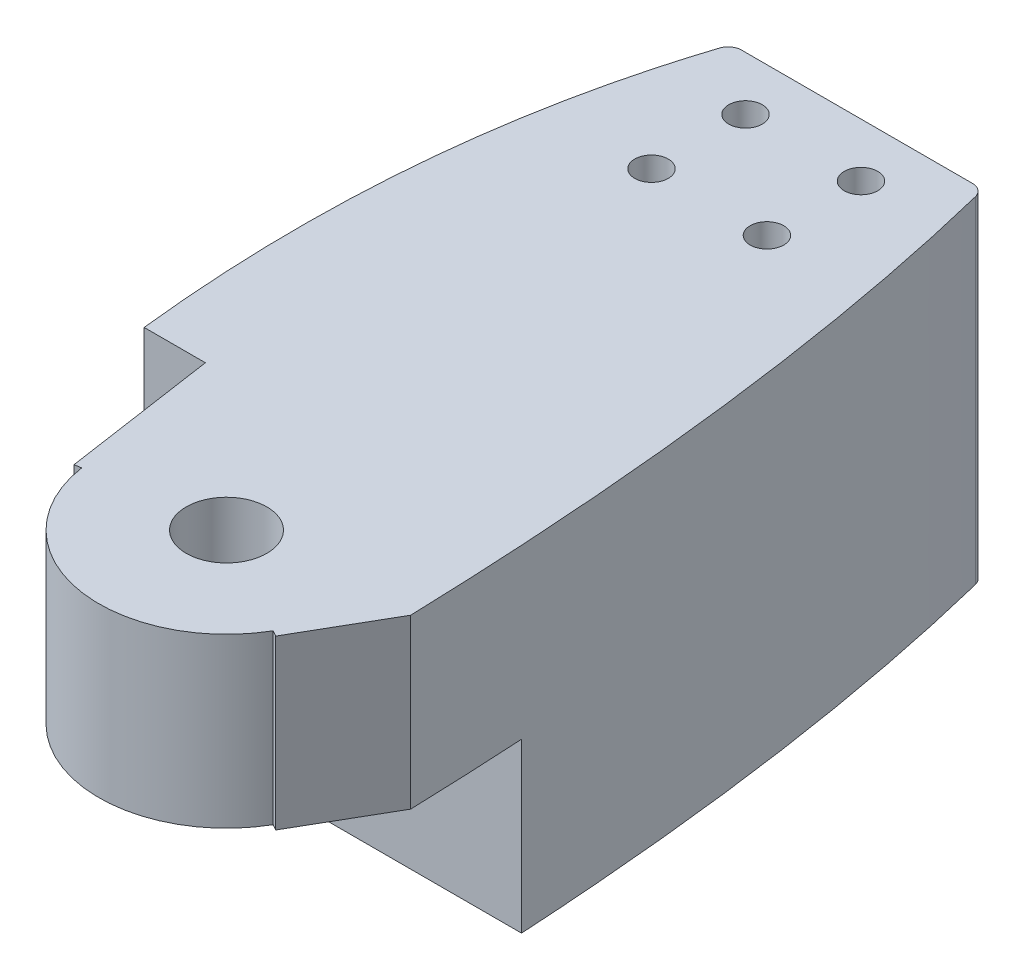
from build123d import *

# Parameters (mm, degrees)
SKETCH_1_W               = 25
SKETCH_1_H               = 25
EXTRUDE_1_DEPTH          = 59.607324229
EXTRUDE_2_DEPTH          = 25
SKETCH_6_3_OUTSIDE_W     = 45.521
SKETCH_6_3_OUTSIDE_H     = 75.803
CUT_EXTRUDE_4_DEPTH      = 25
SKETCH_2_R               = 3
CUT_EXTRUDE_1_DEPTH      = 36.344532851
SKETCH_4_W               = 45.98037926
SKETCH_4_H               = 12.5
CUT_EXTRUDE_2_DEPTH      = 19.5
CUT_EXTRUDE_5_DEPTH      = 17
FILLET_1_R               = 1
CUT_EXTRUDE_6_DEPTH      = 22
CUT_EXTRUDE_6_DEPTH_BACK = 20
SKETCH_8_R               = 1.25
CUT_EXTRUDE_7_DEPTH      = 10
CUT_EXTRUDE_7_DEPTH_BACK = 10
SKETCH_8_3_W             = 4.593346614
SKETCH_8_3_H             = 15


with BuildPart() as part:
    # 스케치1 → 보스-돌출1 (new body)
    with BuildSketch(Plane.XY):
        Rectangle(SKETCH_1_W, SKETCH_1_H)
    extrude(amount=EXTRUDE_1_DEPTH)

    # 스케치6 → 보스-돌출2 (add)
    with BuildSketch(Plane.XZ.offset(12.5)):
        with BuildLine():
            add(Edge.make_bspline(
                [(-12.5, 59.607324229), (-21.149148663, 25.914705571), (-12.5, 0)],
                knots=[0, 0, 0, 1, 1, 1], degree=2))
            Line((-12.5, 0), (-12.5, 59.607324229))
        make_face()
    extrude(amount=-EXTRUDE_2_DEPTH)

    # 스케치6<3> outside → 컷-돌출4 (cut)
    with BuildSketch(Plane.XZ.offset(12.5)):
        with Locations((-2.1625, 29.8035)):
            Rectangle(SKETCH_6_3_OUTSIDE_W, SKETCH_6_3_OUTSIDE_H)
        with BuildLine():
            Line((-12.5, 0), (6.191304912, 0))
            add(Edge.make_bspline(
                [(6.191304912, 0), (12.5, 24.95352193), (12.5, 59.607324229)],
                knots=[0, 0, 0, 1, 1, 1], degree=2))
            Line((12.5, 59.607324229), (-12.5, 59.607324229))
            add(Edge.make_bspline(
                [(-12.5, 59.607324229), (-21.149148663, 25.914705571), (-12.5, 0)],
                knots=[0, 0, 0, 1, 1, 1], degree=2))
        make_face(mode=Mode.SUBTRACT)
    extrude(amount=-CUT_EXTRUDE_4_DEPTH, mode=Mode.SUBTRACT)

    # 스케치2 → 컷-돌출1 (cut)
    with BuildSketch(Plane(origin=(0, 12.5, 0), x_dir=(1, 0, 0), z_dir=(0, 1, 0))):
        with Locations((0, -50.107324229)):
            Circle(SKETCH_2_R)
    extrude(amount=-CUT_EXTRUDE_1_DEPTH, mode=Mode.SUBTRACT)

    # 스케치4 → 컷-돌출2 (cut)
    with BuildSketch(Plane.XY.offset(59.607324229)):
        with Locations((-3.730908459, -6.25)):
            Rectangle(SKETCH_4_W, SKETCH_4_H)
    extrude(amount=-CUT_EXTRUDE_2_DEPTH, mode=Mode.SUBTRACT)

    # 스케치7 → 컷-돌출5 (cut)
    with BuildSketch(Plane.XZ):
        with BuildLine():
            ThreePointArc((0, 59.607324229), (4.75, 58.334565565), (8.227241336, 54.857324229))
            Line((8.227241336, 54.857324229), (8.660254038, 55.107324229))
            Line((8.660254038, 55.107324229), (12.337626898, 48.737927596))
            add(Edge.make_bspline(
                [(12.337626898, 48.737927596), (12.5, 54.047793075), (12.5, 59.607324229)],
                knots=[0, 0, 0, 1, 1, 1], degree=2))
            Line((12.5, 59.607324229), (0, 59.607324229))
        make_face()
        with BuildLine():
            Line((-9.8940238, 51.559320455), (-9.39932261, 51.486720644))
            ThreePointArc((-9.39932261, 51.486720644), (-6.21070584, 57.296005121), (0, 59.607324229))
            Line((0, 59.607324229), (-12.5, 59.607324229))
            add(Edge.make_bspline(
                [(-12.5, 59.607324229), (-15.09259901, 49.507896739), (-16.130924903, 40.107324229)],
                knots=[0, 0, 0, 1, 1, 1], degree=2))
            Line((-16.130924903, 40.107324229), (-11.574660076, 40.107324229))
            Line((-11.574660076, 40.107324229), (-9.8940238, 51.559320455))
        make_face()
    extrude(amount=-CUT_EXTRUDE_5_DEPTH, mode=Mode.SUBTRACT)

    # 필렛1
    fillet_1_edges = [part.edges().sort_by_distance(p)[0] for p in [
        (6.191304912, 0, 0),
        (-12.5, 0, 0),
    ]]
    fillet(fillet_1_edges, radius=FILLET_1_R)

    # 스케치8 → 컷-돌출6 (cut, two sides: drawn at the far end of the back side and taken through both)
    with BuildSketch(Plane(origin=(0, 0, 0), x_dir=(1, 0, 0), z_dir=(0, 1, 0)).offset(-CUT_EXTRUDE_6_DEPTH_BACK)):
        with Locations((1.11398045, -4)):
            Circle(SKETCH_8_R)
        with Locations((1.11398045, -11)):
            Circle(SKETCH_8_R)
        with Locations((-7.479366164, -4)):
            Circle(SKETCH_8_R)
        with Locations((-7.479366164, -11)):
            Circle(SKETCH_8_R)
    extrude(amount=CUT_EXTRUDE_6_DEPTH + CUT_EXTRUDE_6_DEPTH_BACK, mode=Mode.SUBTRACT)

    # 스케치8<3> → 컷-돌출7 (cut, two sides: drawn at the far end of the back side and taken through both)
    with BuildSketch(Plane(origin=(0, 0, 0), x_dir=(1, 0, 0), z_dir=(0, 1, 0)).offset(-CUT_EXTRUDE_7_DEPTH_BACK)):
        with Locations((-7.479366164, -7.5)):
            Rectangle(SKETCH_8_3_W, SKETCH_8_3_H)
        with Locations((1.11398045, -7.5)):
            Rectangle(SKETCH_8_3_W, SKETCH_8_3_H)
    extrude(amount=CUT_EXTRUDE_7_DEPTH + CUT_EXTRUDE_7_DEPTH_BACK, mode=Mode.SUBTRACT)


solid = part.part
